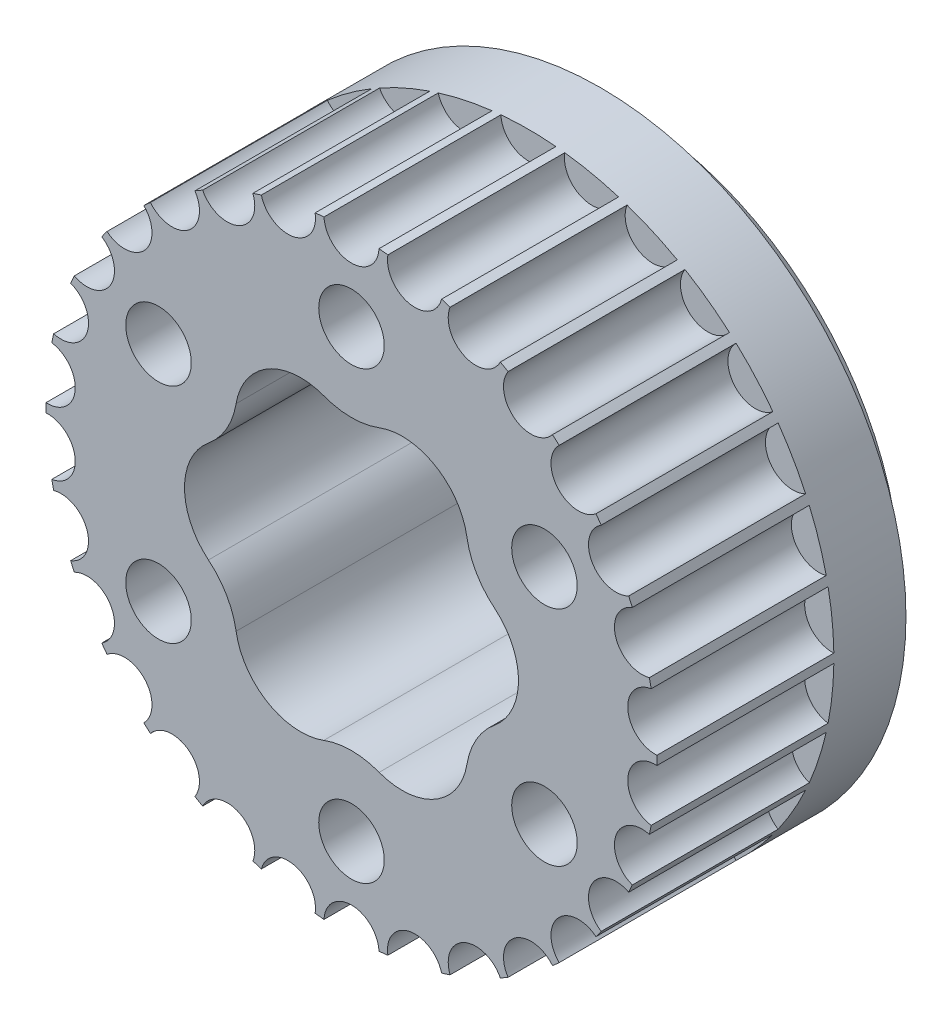
from build123d import *
from build123d.topology import SkipClean

# Parameters (mm, degrees)
CROQUIS1_R                   = 23.305
SALIENTE_EXTRUIR1_DEPTH      = 21
CROQUIS2_R                   = 2.1
CORTAR_EXTRUIR1_DIENTE_DEPTH = 40.079995522
MATRIZC1_DE_DIENTES_COUNT    = 30
SKETCH1_R                    = 23.305
BOSS_EXTRUDE1_DEPTH          = 7.5
SKETCH2_R                    = 23.305
SKETCH2_R_2                  = 22
CUT_EXTRUDE1_DEPTH           = 2
CHAMFER1_SIZE                = 2
CHAMFER1_SIZE_2              = 1.154700538
SKETCH3_R                    = 2.5
CUT_EXTRUDE2_DEPTH           = 40.079995522
CIRPATTERN1_COUNT            = 6
CUT_EXTRUDE3_DEPTH           = 40.079995522
CIRPATTERN2_COUNT            = 6


with BuildPart() as part:
    # Croquis1 → Saliente-Extruir1 (new body)
    with BuildSketch(Plane.XY):
        with Locations(Location((0, 0, 0), (0, 0, 180))):
            Circle(CROQUIS1_R)
    extrude(amount=SALIENTE_EXTRUIR1_DEPTH)

    # Croquis2 → Cortar-Extruir1 diente (cut, through all)
    with BuildSketch(Plane.XY.offset(21)):
        with Locations((0, 23.305)):
            Circle(CROQUIS2_R)
    cortar_extruir1_diente = extrude(amount=-CORTAR_EXTRUIR1_DIENTE_DEPTH, mode=Mode.SUBTRACT)

    # MatrizC1 de dientes: Cortar-Extruir1 diente ×30 about axis
    matrizc1_de_dientes_axis = Axis((0, 0, 0), (0, 0, 1))
    for i in range(1, MATRIZC1_DE_DIENTES_COUNT):
        add(cortar_extruir1_diente.rotate(matrizc1_de_dientes_axis, i * 360 / MATRIZC1_DE_DIENTES_COUNT), mode=Mode.SUBTRACT)

    # Sketch1 → Boss-Extrude1 (add)
    with SkipClean():  # the faces are left unmerged after this step: merging them gives an invalid solid
        with BuildSketch(Plane(origin=(0, 0, 0), x_dir=(-1, 0, 0), z_dir=(0, 0, -1))):
            with Locations(Location((0, 0, 0), (0, 0, 359.164637691))):
                Circle(SKETCH1_R)
        extrude(amount=-BOSS_EXTRUDE1_DEPTH)

    # Sketch2 → Cut-Extrude1 (cut)
    with SkipClean():  # the faces are left unmerged after this step: merging them gives an invalid solid
        with BuildSketch(Plane(origin=(0, 0, 0), x_dir=(-1, 0, 0), z_dir=(0, 0, -1))):
            Circle(SKETCH2_R)
            Circle(SKETCH2_R_2, mode=Mode.SUBTRACT)
        extrude(amount=-CUT_EXTRUDE1_DEPTH, mode=Mode.SUBTRACT)

    # Chamfer1
    # the kernel refuses this chamfer: 2, 1.154700538 mm, written as the material it takes off along each edge
    with BuildSketch(Plane(origin=(0, 0, 0), x_dir=(-1, 0, 0), z_dir=(0, -1, 0))) as chamfer1_piece_1_section:
        Polygon((22, -CHAMFER1_SIZE), (22 - CHAMFER1_SIZE_2, 0), (22, 0), align=None)
    chamfer1_piece_1 = revolve(axis=Axis((0, 0, 0), (0, 0, -1)), revolution_arc=1.835868391, mode=Mode.PRIVATE)
    chamfer1_piece_1 = split(chamfer1_piece_1, bisect_by=Plane(origin=(-21.62879422, 0.346544, 2), z_dir=(0, 0, -1)), keep=Keep.TOP, mode=Mode.PRIVATE)
    with BuildSketch(Plane(origin=(0, 0, 0), x_dir=(-0.9994867007013631, -0.03203646549018377, 0), z_dir=(0.03203646549018377, -0.9994867007013631, 0))) as chamfer1_piece_2_section:
        Polygon((22, -CHAMFER1_SIZE), (22 - CHAMFER1_SIZE_2, 0), (22, 0), align=None)
    chamfer1_piece_2 = revolve(axis=Axis((0, 0, 0), (0, 0, -1)), revolution_arc=1.835868391, mode=Mode.PRIVATE)
    chamfer1_piece_2 = split(chamfer1_piece_2, bisect_by=Plane(origin=(-21.62879422, -0.346544, 2), z_dir=(0, 0, -1)), keep=Keep.TOP, mode=Mode.PRIVATE)
    with BuildSketch(Plane(origin=(0, 0, 0), x_dir=(-0.9994867007013631, 0.0320364654901831, 0), z_dir=(-0.0320364654901831, -0.9994867007013631, 0))) as chamfer1_piece_3_section:
        Polygon((22, -CHAMFER1_SIZE), (22 - CHAMFER1_SIZE_2, 0), (22, 0), align=None)
    chamfer1_piece_3 = revolve(axis=Axis((0, 0, 0), (0, 0, -1)), revolution_arc=8.328263219, mode=Mode.PRIVATE)
    chamfer1_piece_3 = split(chamfer1_piece_3, bisect_by=Plane(origin=(-21.495055877, 2.25922141, 2), z_dir=(0, 0, -1)), keep=Keep.TOP, mode=Mode.PRIVATE)
    with BuildSketch(Plane(origin=(0, 0, 0), x_dir=(-0.9843062739642783, 0.17646857803744895, 0), z_dir=(-0.17646857803744895, -0.9843062739642783, 0))) as chamfer1_piece_4_section:
        Polygon((22, -CHAMFER1_SIZE), (22 - CHAMFER1_SIZE_2, 0), (22, 0), align=None)
    chamfer1_piece_4 = revolve(axis=Axis((0, 0, 0), (0, 0, -1)), revolution_arc=3.671736781, mode=Mode.PRIVATE)
    chamfer1_piece_4 = split(chamfer1_piece_4, bisect_by=Plane(origin=(-21.156153173, 4.496879177, 2), z_dir=(0, 0, -1)), keep=Keep.TOP, mode=Mode.PRIVATE)
    with BuildSketch(Plane(origin=(0, 0, 0), x_dir=(-0.9709847625484951, 0.23914136174790543, 0), z_dir=(-0.23914136174790543, -0.9709847625484951, 0))) as chamfer1_piece_5_section:
        Polygon((22, -CHAMFER1_SIZE), (22 - CHAMFER1_SIZE_2, 0), (22, 0), align=None)
    chamfer1_piece_5 = revolve(axis=Axis((0, 0, 0), (0, 0, -1)), revolution_arc=8.328263219, mode=Mode.PRIVATE)
    chamfer1_piece_5 = split(chamfer1_piece_5, bisect_by=Plane(origin=(-20.555618791, 6.678925413, 2), z_dir=(0, 0, -1)), keep=Keep.TOP, mode=Mode.PRIVATE)
    with BuildSketch(Plane(origin=(0, 0, 0), x_dir=(-0.9261069398293998, 0.37726109791472595, 0), z_dir=(-0.37726109791472595, -0.9261069398293998, 0))) as chamfer1_piece_6_section:
        Polygon((22, -CHAMFER1_SIZE), (22 - CHAMFER1_SIZE_2, 0), (22, 0), align=None)
    chamfer1_piece_6 = revolve(axis=Axis((0, 0, 0), (0, 0, -1)), revolution_arc=3.671736781, mode=Mode.PRIVATE)
    chamfer1_piece_6 = split(chamfer1_piece_6, bisect_by=Plane(origin=(-19.758886714, 8.797223155, 2), z_dir=(0, 0, -1)), keep=Keep.TOP, mode=Mode.PRIVATE)
    with BuildSketch(Plane(origin=(0, 0, 0), x_dir=(-0.9000461309704239, 0.43579463296967164, 0), z_dir=(-0.43579463296967164, -0.9000461309704239, 0))) as chamfer1_piece_7_section:
        Polygon((22, -CHAMFER1_SIZE), (22 - CHAMFER1_SIZE_2, 0), (22, 0), align=None)
    chamfer1_piece_7 = revolve(axis=Axis((0, 0, 0), (0, 0, -1)), revolution_arc=8.328263219, mode=Mode.PRIVATE)
    chamfer1_piece_7 = split(chamfer1_piece_7, bisect_by=Plane(origin=(-18.717802526, 10.806728327, 2), z_dir=(0, 0, -1)), keep=Keep.TOP, mode=Mode.PRIVATE)
    with BuildSketch(Plane(origin=(0, 0, 0), x_dir=(-0.8274322884698772, 0.5615654975134264, 0), z_dir=(-0.5615654975134264, -0.8274322884698772, 0))) as chamfer1_piece_8_section:
        Polygon((22, -CHAMFER1_SIZE), (22 - CHAMFER1_SIZE_2, 0), (22, 0), align=None)
    chamfer1_piece_8 = revolve(axis=Axis((0, 0, 0), (0, 0, -1)), revolution_arc=3.671736781, mode=Mode.PRIVATE)
    chamfer1_piece_8 = split(chamfer1_piece_8, bisect_by=Plane(origin=(-17.498062092, 12.713086267, 2), z_dir=(0, 0, -1)), keep=Keep.TOP, mode=Mode.PRIVATE)
    with BuildSketch(Plane(origin=(0, 0, 0), x_dir=(-0.7897711645684304, 0.6134015875560033, 0), z_dir=(-0.6134015875560033, -0.7897711645684304, 0))) as chamfer1_piece_9_section:
        Polygon((22, -CHAMFER1_SIZE), (22 - CHAMFER1_SIZE_2, 0), (22, 0), align=None)
    chamfer1_piece_9 = revolve(axis=Axis((0, 0, 0), (0, 0, -1)), revolution_arc=8.328263219, mode=Mode.PRIVATE)
    chamfer1_piece_9 = split(chamfer1_piece_9, bisect_by=Plane(origin=(-16.061928473, 14.462225357, 2), z_dir=(0, 0, -1)), keep=Keep.TOP, mode=Mode.PRIVATE)
    with BuildSketch(Plane(origin=(0, 0, 0), x_dir=(-0.6925948756435667, 0.7213267901806174, 0), z_dir=(-0.7213267901806174, -0.6925948756435667, 0))) as chamfer1_piece_10_section:
        Polygon((22, -CHAMFER1_SIZE), (22 - CHAMFER1_SIZE_2, 0), (22, 0), align=None)
    chamfer1_piece_10 = revolve(axis=Axis((0, 0, 0), (0, 0, -1)), revolution_arc=3.671736781, mode=Mode.PRIVATE)
    chamfer1_piece_10 = split(chamfer1_piece_10, bisect_by=Plane(origin=(-14.472488191, 16.073326506, 2), z_dir=(0, 0, -1)), keep=Keep.TOP, mode=Mode.PRIVATE)
    with BuildSketch(Plane(origin=(0, 0, 0), x_dir=(-0.6449794085322867, 0.7641999493387456, 0), z_dir=(-0.7641999493387456, -0.6449794085322867, 0))) as chamfer1_piece_11_section:
        Polygon((22, -CHAMFER1_SIZE), (22 - CHAMFER1_SIZE_2, 0), (22, 0), align=None)
    chamfer1_piece_11 = revolve(axis=Axis((0, 0, 0), (0, 0, -1)), revolution_arc=8.328263219, mode=Mode.PRIVATE)
    chamfer1_piece_11 = split(chamfer1_piece_11, bisect_by=Plane(origin=(-12.704071072, 17.48565374, 2), z_dir=(0, 0, -1)), keep=Keep.TOP, mode=Mode.PRIVATE)
    with BuildSketch(Plane(origin=(0, 0, 0), x_dir=(-0.5274877433126552, 0.8495626408069756, 0), z_dir=(-0.8495626408069756, -0.5274877433126552, 0))) as chamfer1_piece_12_section:
        Polygon((22, -CHAMFER1_SIZE), (22 - CHAMFER1_SIZE_2, 0), (22, 0), align=None)
    chamfer1_piece_12 = revolve(axis=Axis((0, 0, 0), (0, 0, -1)), revolution_arc=3.671736781, mode=Mode.PRIVATE)
    chamfer1_piece_12 = split(chamfer1_piece_12, bisect_by=Plane(origin=(-10.81439711, 18.731085248, 2), z_dir=(0, 0, -1)), keep=Keep.TOP, mode=Mode.PRIVATE)
    with BuildSketch(Plane(origin=(0, 0, 0), x_dir=(-0.47199895738871417, 0.8815991062971688, 0), z_dir=(-0.8815991062971688, -0.47199895738871417, 0))) as chamfer1_piece_13_section:
        Polygon((22, -CHAMFER1_SIZE), (22 - CHAMFER1_SIZE_2, 0), (22, 0), align=None)
    chamfer1_piece_13 = revolve(axis=Axis((0, 0, 0), (0, 0, -1)), revolution_arc=8.328263219, mode=Mode.PRIVATE)
    chamfer1_piece_13 = split(chamfer1_piece_13, bisect_by=Plane(origin=(-8.790984805, 19.74487515, 2), z_dir=(0, 0, -1)), keep=Keep.TOP, mode=Mode.PRIVATE)
    with BuildSketch(Plane(origin=(0, 0, 0), x_dir=(-0.3393268654320094, 0.9406685273761884, 0), z_dir=(-0.9406685273761884, -0.3393268654320094, 0))) as chamfer1_piece_14_section:
        Polygon((22, -CHAMFER1_SIZE), (22 - CHAMFER1_SIZE_2, 0), (22, 0), align=None)
    chamfer1_piece_14 = revolve(axis=Axis((0, 0, 0), (0, 0, -1)), revolution_arc=3.671736781, mode=Mode.PRIVATE)
    chamfer1_piece_14 = split(chamfer1_piece_14, bisect_by=Plane(origin=(-6.683664982, 20.570205683, 2), z_dir=(0, 0, -1)), keep=Keep.TOP, mode=Mode.PRIVATE)
    with BuildSketch(Plane(origin=(0, 0, 0), x_dir=(-0.2783898869049189, 0.9604681519285616, 0), z_dir=(-0.9604681519285616, -0.2783898869049189, 0))) as chamfer1_piece_15_section:
        Polygon((22, -CHAMFER1_SIZE), (22 - CHAMFER1_SIZE_2, 0), (22, 0), align=None)
    chamfer1_piece_15 = revolve(axis=Axis((0, 0, 0), (0, 0, -1)), revolution_arc=8.328263219, mode=Mode.PRIVATE)
    chamfer1_piece_15 = split(chamfer1_piece_15, bisect_by=Plane(origin=(-4.493690317, 21.14115077, 2), z_dir=(0, 0, -1)), keep=Keep.TOP, mode=Mode.PRIVATE)
    with BuildSketch(Plane(origin=(0, 0, 0), x_dir=(-0.13633577526100446, 0.9906626854706807, 0), z_dir=(-0.9906626854706807, -0.13633577526100446, 0))) as chamfer1_piece_16_section:
        Polygon((22, -CHAMFER1_SIZE), (22 - CHAMFER1_SIZE_2, 0), (22, 0), align=None)
    chamfer1_piece_16 = revolve(axis=Axis((0, 0, 0), (0, 0, -1)), revolution_arc=3.671736781, mode=Mode.PRIVATE)
    chamfer1_piece_16 = split(chamfer1_piece_16, bisect_by=Plane(origin=(-2.260824622, 21.510309422, 2), z_dir=(0, 0, -1)), keep=Keep.TOP, mode=Mode.PRIVATE)
    with BuildSketch(Plane(origin=(0, 0, 0), x_dir=(-0.07261384250057941, 0.9973601304831174, 0), z_dir=(-0.9973601304831174, -0.07261384250057941, 0))) as chamfer1_piece_17_section:
        Polygon((22, -CHAMFER1_SIZE), (22 - CHAMFER1_SIZE_2, 0), (22, 0), align=None)
    chamfer1_piece_17 = revolve(axis=Axis((0, 0, 0), (0, 0, -1)), revolution_arc=8.328263219, mode=Mode.PRIVATE)
    chamfer1_piece_17 = split(chamfer1_piece_17, bisect_by=Plane(origin=(0, 21.613456654, 2), z_dir=(0, 0, -1)), keep=Keep.TOP, mode=Mode.PRIVATE)
    with BuildSketch(Plane(origin=(0, 0, 0), x_dir=(0.0726138425005795, 0.9973601304831174, 0), z_dir=(-0.9973601304831174, 0.0726138425005795, 0))) as chamfer1_piece_18_section:
        Polygon((22, -CHAMFER1_SIZE), (22 - CHAMFER1_SIZE_2, 0), (22, 0), align=None)
    chamfer1_piece_18 = revolve(axis=Axis((0, 0, 0), (0, 0, -1)), revolution_arc=3.671736781, mode=Mode.PRIVATE)
    chamfer1_piece_18 = split(chamfer1_piece_18, bisect_by=Plane(origin=(2.260824622, 21.510309422, 2), z_dir=(0, 0, -1)), keep=Keep.TOP, mode=Mode.PRIVATE)
    with BuildSketch(Plane(origin=(0, 0, 0), x_dir=(0.1363357752610048, 0.9906626854706807, 0), z_dir=(-0.9906626854706807, 0.1363357752610048, 0))) as chamfer1_piece_19_section:
        Polygon((22, -CHAMFER1_SIZE), (22 - CHAMFER1_SIZE_2, 0), (22, 0), align=None)
    chamfer1_piece_19 = revolve(axis=Axis((0, 0, 0), (0, 0, -1)), revolution_arc=8.328263219, mode=Mode.PRIVATE)
    chamfer1_piece_19 = split(chamfer1_piece_19, bisect_by=Plane(origin=(4.493690317, 21.14115077, 2), z_dir=(0, 0, -1)), keep=Keep.TOP, mode=Mode.PRIVATE)
    with BuildSketch(Plane(origin=(0, 0, 0), x_dir=(0.27838988690491984, 0.9604681519285613, 0), z_dir=(-0.9604681519285613, 0.27838988690491984, 0))) as chamfer1_piece_20_section:
        Polygon((22, -CHAMFER1_SIZE), (22 - CHAMFER1_SIZE_2, 0), (22, 0), align=None)
    chamfer1_piece_20 = revolve(axis=Axis((0, 0, 0), (0, 0, -1)), revolution_arc=3.671736781, mode=Mode.PRIVATE)
    chamfer1_piece_20 = split(chamfer1_piece_20, bisect_by=Plane(origin=(6.683664982, 20.570205683, 2), z_dir=(0, 0, -1)), keep=Keep.TOP, mode=Mode.PRIVATE)
    with BuildSketch(Plane(origin=(0, 0, 0), x_dir=(0.3393268654320093, 0.9406685273761884, 0), z_dir=(-0.9406685273761884, 0.3393268654320093, 0))) as chamfer1_piece_21_section:
        Polygon((22, -CHAMFER1_SIZE), (22 - CHAMFER1_SIZE_2, 0), (22, 0), align=None)
    chamfer1_piece_21 = revolve(axis=Axis((0, 0, 0), (0, 0, -1)), revolution_arc=8.328263219, mode=Mode.PRIVATE)
    chamfer1_piece_21 = split(chamfer1_piece_21, bisect_by=Plane(origin=(8.790984805, 19.74487515, 2), z_dir=(0, 0, -1)), keep=Keep.TOP, mode=Mode.PRIVATE)
    with BuildSketch(Plane(origin=(0, 0, 0), x_dir=(0.4719989573887134, 0.8815991062971693, 0), z_dir=(-0.8815991062971693, 0.4719989573887134, 0))) as chamfer1_piece_22_section:
        Polygon((22, -CHAMFER1_SIZE), (22 - CHAMFER1_SIZE_2, 0), (22, 0), align=None)
    chamfer1_piece_22 = revolve(axis=Axis((0, 0, 0), (0, 0, -1)), revolution_arc=3.671736781, mode=Mode.PRIVATE)
    chamfer1_piece_22 = split(chamfer1_piece_22, bisect_by=Plane(origin=(10.81439711, 18.731085248, 2), z_dir=(0, 0, -1)), keep=Keep.TOP, mode=Mode.PRIVATE)
    with BuildSketch(Plane(origin=(0, 0, 0), x_dir=(0.5274877433126551, 0.8495626408069757, 0), z_dir=(-0.8495626408069757, 0.5274877433126551, 0))) as chamfer1_piece_23_section:
        Polygon((22, -CHAMFER1_SIZE), (22 - CHAMFER1_SIZE_2, 0), (22, 0), align=None)
    chamfer1_piece_23 = revolve(axis=Axis((0, 0, 0), (0, 0, -1)), revolution_arc=8.328263219, mode=Mode.PRIVATE)
    chamfer1_piece_23 = split(chamfer1_piece_23, bisect_by=Plane(origin=(12.704071072, 17.48565374, 2), z_dir=(0, 0, -1)), keep=Keep.TOP, mode=Mode.PRIVATE)
    with BuildSketch(Plane(origin=(0, 0, 0), x_dir=(0.6449794085322867, 0.7641999493387456, 0), z_dir=(-0.7641999493387456, 0.6449794085322867, 0))) as chamfer1_piece_24_section:
        Polygon((22, -CHAMFER1_SIZE), (22 - CHAMFER1_SIZE_2, 0), (22, 0), align=None)
    chamfer1_piece_24 = revolve(axis=Axis((0, 0, 0), (0, 0, -1)), revolution_arc=3.671736781, mode=Mode.PRIVATE)
    chamfer1_piece_24 = split(chamfer1_piece_24, bisect_by=Plane(origin=(14.472488191, 16.073326506, 2), z_dir=(0, 0, -1)), keep=Keep.TOP, mode=Mode.PRIVATE)
    with BuildSketch(Plane(origin=(0, 0, 0), x_dir=(0.6925948756435674, 0.7213267901806167, 0), z_dir=(-0.7213267901806167, 0.6925948756435674, 0))) as chamfer1_piece_25_section:
        Polygon((22, -CHAMFER1_SIZE), (22 - CHAMFER1_SIZE_2, 0), (22, 0), align=None)
    chamfer1_piece_25 = revolve(axis=Axis((0, 0, 0), (0, 0, -1)), revolution_arc=8.328263219, mode=Mode.PRIVATE)
    chamfer1_piece_25 = split(chamfer1_piece_25, bisect_by=Plane(origin=(16.061928473, 14.462225357, 2), z_dir=(0, 0, -1)), keep=Keep.TOP, mode=Mode.PRIVATE)
    with BuildSketch(Plane(origin=(0, 0, 0), x_dir=(0.7897711645684308, 0.6134015875560028, 0), z_dir=(-0.6134015875560028, 0.7897711645684308, 0))) as chamfer1_piece_26_section:
        Polygon((22, -CHAMFER1_SIZE), (22 - CHAMFER1_SIZE_2, 0), (22, 0), align=None)
    chamfer1_piece_26 = revolve(axis=Axis((0, 0, 0), (0, 0, -1)), revolution_arc=3.671736781, mode=Mode.PRIVATE)
    chamfer1_piece_26 = split(chamfer1_piece_26, bisect_by=Plane(origin=(17.498062092, 12.713086267, 2), z_dir=(0, 0, -1)), keep=Keep.TOP, mode=Mode.PRIVATE)
    with BuildSketch(Plane(origin=(0, 0, 0), x_dir=(0.8274322884698773, 0.5615654975134262, 0), z_dir=(-0.5615654975134262, 0.8274322884698773, 0))) as chamfer1_piece_27_section:
        Polygon((22, -CHAMFER1_SIZE), (22 - CHAMFER1_SIZE_2, 0), (22, 0), align=None)
    chamfer1_piece_27 = revolve(axis=Axis((0, 0, 0), (0, 0, -1)), revolution_arc=8.328263219, mode=Mode.PRIVATE)
    chamfer1_piece_27 = split(chamfer1_piece_27, bisect_by=Plane(origin=(18.717802526, 10.806728327, 2), z_dir=(0, 0, -1)), keep=Keep.TOP, mode=Mode.PRIVATE)
    with BuildSketch(Plane(origin=(0, 0, 0), x_dir=(0.9000461309704235, 0.435794632969672, 0), z_dir=(-0.435794632969672, 0.9000461309704235, 0))) as chamfer1_piece_28_section:
        Polygon((22, -CHAMFER1_SIZE), (22 - CHAMFER1_SIZE_2, 0), (22, 0), align=None)
    chamfer1_piece_28 = revolve(axis=Axis((0, 0, 0), (0, 0, -1)), revolution_arc=3.671736781, mode=Mode.PRIVATE)
    chamfer1_piece_28 = split(chamfer1_piece_28, bisect_by=Plane(origin=(19.758886714, 8.797223155, 2), z_dir=(0, 0, -1)), keep=Keep.TOP, mode=Mode.PRIVATE)
    with BuildSketch(Plane(origin=(0, 0, 0), x_dir=(0.9261069398293997, 0.3772610979147262, 0), z_dir=(-0.3772610979147262, 0.9261069398293997, 0))) as chamfer1_piece_29_section:
        Polygon((22, -CHAMFER1_SIZE), (22 - CHAMFER1_SIZE_2, 0), (22, 0), align=None)
    chamfer1_piece_29 = revolve(axis=Axis((0, 0, 0), (0, 0, -1)), revolution_arc=8.328263219, mode=Mode.PRIVATE)
    chamfer1_piece_29 = split(chamfer1_piece_29, bisect_by=Plane(origin=(20.555618791, 6.678925413, 2), z_dir=(0, 0, -1)), keep=Keep.TOP, mode=Mode.PRIVATE)
    with BuildSketch(Plane(origin=(0, 0, 0), x_dir=(0.9709847625484951, 0.23914136174790543, 0), z_dir=(-0.23914136174790543, 0.9709847625484951, 0))) as chamfer1_piece_30_section:
        Polygon((22, -CHAMFER1_SIZE), (22 - CHAMFER1_SIZE_2, 0), (22, 0), align=None)
    chamfer1_piece_30 = revolve(axis=Axis((0, 0, 0), (0, 0, -1)), revolution_arc=3.671736781, mode=Mode.PRIVATE)
    chamfer1_piece_30 = split(chamfer1_piece_30, bisect_by=Plane(origin=(21.156153173, 4.496879177, 2), z_dir=(0, 0, -1)), keep=Keep.TOP, mode=Mode.PRIVATE)
    with BuildSketch(Plane(origin=(0, 0, 0), x_dir=(0.9843062739642783, 0.17646857803744878, 0), z_dir=(-0.17646857803744878, 0.9843062739642783, 0))) as chamfer1_piece_31_section:
        Polygon((22, -CHAMFER1_SIZE), (22 - CHAMFER1_SIZE_2, 0), (22, 0), align=None)
    chamfer1_piece_31 = revolve(axis=Axis((0, 0, 0), (0, 0, -1)), revolution_arc=8.328263219, mode=Mode.PRIVATE)
    chamfer1_piece_31 = split(chamfer1_piece_31, bisect_by=Plane(origin=(21.495055877, 2.25922141, 2), z_dir=(0, 0, -1)), keep=Keep.TOP, mode=Mode.PRIVATE)
    with BuildSketch(Plane(origin=(0, 0, 0), x_dir=(0.9994867007013631, 0.032036465490183644, 0), z_dir=(-0.032036465490183644, 0.9994867007013631, 0))) as chamfer1_piece_32_section:
        Polygon((22, -CHAMFER1_SIZE), (22 - CHAMFER1_SIZE_2, 0), (22, 0), align=None)
    chamfer1_piece_32 = revolve(axis=Axis((0, 0, 0), (0, 0, -1)), revolution_arc=3.671736781, mode=Mode.PRIVATE)
    chamfer1_piece_32 = split(chamfer1_piece_32, bisect_by=Plane(origin=(21.62879422, 0, 2), z_dir=(0, 0, -1)), keep=Keep.TOP, mode=Mode.PRIVATE)
    with BuildSketch(Plane(origin=(0, 0, 0), x_dir=(0.9994867007013631, -0.0320364654901834, 0), z_dir=(0.0320364654901834, 0.9994867007013631, 0))) as chamfer1_piece_33_section:
        Polygon((22, -CHAMFER1_SIZE), (22 - CHAMFER1_SIZE_2, 0), (22, 0), align=None)
    chamfer1_piece_33 = revolve(axis=Axis((0, 0, 0), (0, 0, -1)), revolution_arc=8.328263219, mode=Mode.PRIVATE)
    chamfer1_piece_33 = split(chamfer1_piece_33, bisect_by=Plane(origin=(21.495055877, -2.25922141, 2), z_dir=(0, 0, -1)), keep=Keep.TOP, mode=Mode.PRIVATE)
    with BuildSketch(Plane(origin=(0, 0, 0), x_dir=(0.9843062739642785, -0.17646857803744811, 0), z_dir=(0.17646857803744811, 0.9843062739642785, 0))) as chamfer1_piece_34_section:
        Polygon((22, -CHAMFER1_SIZE), (22 - CHAMFER1_SIZE_2, 0), (22, 0), align=None)
    chamfer1_piece_34 = revolve(axis=Axis((0, 0, 0), (0, 0, -1)), revolution_arc=3.671736781, mode=Mode.PRIVATE)
    chamfer1_piece_34 = split(chamfer1_piece_34, bisect_by=Plane(origin=(21.156153173, -4.496879177, 2), z_dir=(0, 0, -1)), keep=Keep.TOP, mode=Mode.PRIVATE)
    with BuildSketch(Plane(origin=(0, 0, 0), x_dir=(0.9709847625484952, -0.23914136174790476, 0), z_dir=(0.23914136174790476, 0.9709847625484952, 0))) as chamfer1_piece_35_section:
        Polygon((22, -CHAMFER1_SIZE), (22 - CHAMFER1_SIZE_2, 0), (22, 0), align=None)
    chamfer1_piece_35 = revolve(axis=Axis((0, 0, 0), (0, 0, -1)), revolution_arc=8.328263219, mode=Mode.PRIVATE)
    chamfer1_piece_35 = split(chamfer1_piece_35, bisect_by=Plane(origin=(20.555618791, -6.678925413, 2), z_dir=(0, 0, -1)), keep=Keep.TOP, mode=Mode.PRIVATE)
    with BuildSketch(Plane(origin=(0, 0, 0), x_dir=(0.9261069398293998, -0.37726109791472595, 0), z_dir=(0.37726109791472595, 0.9261069398293998, 0))) as chamfer1_piece_36_section:
        Polygon((22, -CHAMFER1_SIZE), (22 - CHAMFER1_SIZE_2, 0), (22, 0), align=None)
    chamfer1_piece_36 = revolve(axis=Axis((0, 0, 0), (0, 0, -1)), revolution_arc=3.671736781, mode=Mode.PRIVATE)
    chamfer1_piece_36 = split(chamfer1_piece_36, bisect_by=Plane(origin=(19.758886714, -8.797223155, 2), z_dir=(0, 0, -1)), keep=Keep.TOP, mode=Mode.PRIVATE)
    with BuildSketch(Plane(origin=(0, 0, 0), x_dir=(0.9000461309704236, -0.4357946329696718, 0), z_dir=(0.4357946329696718, 0.9000461309704236, 0))) as chamfer1_piece_37_section:
        Polygon((22, -CHAMFER1_SIZE), (22 - CHAMFER1_SIZE_2, 0), (22, 0), align=None)
    chamfer1_piece_37 = revolve(axis=Axis((0, 0, 0), (0, 0, -1)), revolution_arc=8.328263219, mode=Mode.PRIVATE)
    chamfer1_piece_37 = split(chamfer1_piece_37, bisect_by=Plane(origin=(18.717802526, -10.806728327, 2), z_dir=(0, 0, -1)), keep=Keep.TOP, mode=Mode.PRIVATE)
    with BuildSketch(Plane(origin=(0, 0, 0), x_dir=(0.8274322884698772, -0.5615654975134263, 0), z_dir=(0.5615654975134263, 0.8274322884698772, 0))) as chamfer1_piece_38_section:
        Polygon((22, -CHAMFER1_SIZE), (22 - CHAMFER1_SIZE_2, 0), (22, 0), align=None)
    chamfer1_piece_38 = revolve(axis=Axis((0, 0, 0), (0, 0, -1)), revolution_arc=3.671736781, mode=Mode.PRIVATE)
    chamfer1_piece_38 = split(chamfer1_piece_38, bisect_by=Plane(origin=(17.498062092, -12.713086267, 2), z_dir=(0, 0, -1)), keep=Keep.TOP, mode=Mode.PRIVATE)
    with BuildSketch(Plane(origin=(0, 0, 0), x_dir=(0.789771164568431, -0.6134015875560026, 0), z_dir=(0.6134015875560026, 0.789771164568431, 0))) as chamfer1_piece_39_section:
        Polygon((22, -CHAMFER1_SIZE), (22 - CHAMFER1_SIZE_2, 0), (22, 0), align=None)
    chamfer1_piece_39 = revolve(axis=Axis((0, 0, 0), (0, 0, -1)), revolution_arc=8.328263219, mode=Mode.PRIVATE)
    chamfer1_piece_39 = split(chamfer1_piece_39, bisect_by=Plane(origin=(16.061928473, -14.462225357, 2), z_dir=(0, 0, -1)), keep=Keep.TOP, mode=Mode.PRIVATE)
    with BuildSketch(Plane(origin=(0, 0, 0), x_dir=(0.6925948756435676, -0.7213267901806165, 0), z_dir=(0.7213267901806165, 0.6925948756435676, 0))) as chamfer1_piece_40_section:
        Polygon((22, -CHAMFER1_SIZE), (22 - CHAMFER1_SIZE_2, 0), (22, 0), align=None)
    chamfer1_piece_40 = revolve(axis=Axis((0, 0, 0), (0, 0, -1)), revolution_arc=3.671736781, mode=Mode.PRIVATE)
    chamfer1_piece_40 = split(chamfer1_piece_40, bisect_by=Plane(origin=(14.472488191, -16.073326506, 2), z_dir=(0, 0, -1)), keep=Keep.TOP, mode=Mode.PRIVATE)
    with BuildSketch(Plane(origin=(0, 0, 0), x_dir=(0.6449794085322877, -0.7641999493387449, 0), z_dir=(0.7641999493387449, 0.6449794085322877, 0))) as chamfer1_piece_41_section:
        Polygon((22, -CHAMFER1_SIZE), (22 - CHAMFER1_SIZE_2, 0), (22, 0), align=None)
    chamfer1_piece_41 = revolve(axis=Axis((0, 0, 0), (0, 0, -1)), revolution_arc=8.328263219, mode=Mode.PRIVATE)
    chamfer1_piece_41 = split(chamfer1_piece_41, bisect_by=Plane(origin=(12.704071072, -17.48565374, 2), z_dir=(0, 0, -1)), keep=Keep.TOP, mode=Mode.PRIVATE)
    with BuildSketch(Plane(origin=(0, 0, 0), x_dir=(0.5274877433126549, -0.849562640806976, 0), z_dir=(0.849562640806976, 0.5274877433126549, 0))) as chamfer1_piece_42_section:
        Polygon((22, -CHAMFER1_SIZE), (22 - CHAMFER1_SIZE_2, 0), (22, 0), align=None)
    chamfer1_piece_42 = revolve(axis=Axis((0, 0, 0), (0, 0, -1)), revolution_arc=3.671736781, mode=Mode.PRIVATE)
    chamfer1_piece_42 = split(chamfer1_piece_42, bisect_by=Plane(origin=(10.81439711, -18.731085248, 2), z_dir=(0, 0, -1)), keep=Keep.TOP, mode=Mode.PRIVATE)
    with BuildSketch(Plane(origin=(0, 0, 0), x_dir=(0.4719989573887141, -0.881599106297169, 0), z_dir=(0.881599106297169, 0.4719989573887141, 0))) as chamfer1_piece_43_section:
        Polygon((22, -CHAMFER1_SIZE), (22 - CHAMFER1_SIZE_2, 0), (22, 0), align=None)
    chamfer1_piece_43 = revolve(axis=Axis((0, 0, 0), (0, 0, -1)), revolution_arc=8.328263219, mode=Mode.PRIVATE)
    chamfer1_piece_43 = split(chamfer1_piece_43, bisect_by=Plane(origin=(8.790984805, -19.74487515, 2), z_dir=(0, 0, -1)), keep=Keep.TOP, mode=Mode.PRIVATE)
    with BuildSketch(Plane(origin=(0, 0, 0), x_dir=(0.3393268654320087, -0.9406685273761887, 0), z_dir=(0.9406685273761887, 0.3393268654320087, 0))) as chamfer1_piece_44_section:
        Polygon((22, -CHAMFER1_SIZE), (22 - CHAMFER1_SIZE_2, 0), (22, 0), align=None)
    chamfer1_piece_44 = revolve(axis=Axis((0, 0, 0), (0, 0, -1)), revolution_arc=3.671736781, mode=Mode.PRIVATE)
    chamfer1_piece_44 = split(chamfer1_piece_44, bisect_by=Plane(origin=(6.683664982, -20.570205683, 2), z_dir=(0, 0, -1)), keep=Keep.TOP, mode=Mode.PRIVATE)
    with BuildSketch(Plane(origin=(0, 0, 0), x_dir=(0.27838988690491984, -0.9604681519285613, 0), z_dir=(0.9604681519285613, 0.27838988690491984, 0))) as chamfer1_piece_45_section:
        Polygon((22, -CHAMFER1_SIZE), (22 - CHAMFER1_SIZE_2, 0), (22, 0), align=None)
    chamfer1_piece_45 = revolve(axis=Axis((0, 0, 0), (0, 0, -1)), revolution_arc=8.328263219, mode=Mode.PRIVATE)
    chamfer1_piece_45 = split(chamfer1_piece_45, bisect_by=Plane(origin=(4.493690317, -21.14115077, 2), z_dir=(0, 0, -1)), keep=Keep.TOP, mode=Mode.PRIVATE)
    with BuildSketch(Plane(origin=(0, 0, 0), x_dir=(0.13633577526100416, -0.9906626854706808, 0), z_dir=(0.9906626854706808, 0.13633577526100416, 0))) as chamfer1_piece_46_section:
        Polygon((22, -CHAMFER1_SIZE), (22 - CHAMFER1_SIZE_2, 0), (22, 0), align=None)
    chamfer1_piece_46 = revolve(axis=Axis((0, 0, 0), (0, 0, -1)), revolution_arc=3.671736781, mode=Mode.PRIVATE)
    chamfer1_piece_46 = split(chamfer1_piece_46, bisect_by=Plane(origin=(2.260824622, -21.510309422, 2), z_dir=(0, 0, -1)), keep=Keep.TOP, mode=Mode.PRIVATE)
    with BuildSketch(Plane(origin=(0, 0, 0), x_dir=(0.07261384250053833, -0.9973601304831203, 0), z_dir=(0.9973601304831203, 0.07261384250053833, 0))) as chamfer1_piece_47_section:
        Polygon((22, -CHAMFER1_SIZE), (22 - CHAMFER1_SIZE_2, 0), (22, 0), align=None)
    chamfer1_piece_47 = revolve(axis=Axis((0, 0, 0), (0, 0, -1)), revolution_arc=8.328263219, mode=Mode.PRIVATE)
    chamfer1_piece_47 = split(chamfer1_piece_47, bisect_by=Plane(origin=(0, -21.613456654, 2), z_dir=(0, 0, -1)), keep=Keep.TOP, mode=Mode.PRIVATE)
    with BuildSketch(Plane(origin=(0, 0, 0), x_dir=(-0.07261384250053797, -0.9973601304831203, 0), z_dir=(0.9973601304831203, -0.07261384250053797, 0))) as chamfer1_piece_48_section:
        Polygon((22, -CHAMFER1_SIZE), (22 - CHAMFER1_SIZE_2, 0), (22, 0), align=None)
    chamfer1_piece_48 = revolve(axis=Axis((0, 0, 0), (0, 0, -1)), revolution_arc=3.671736781, mode=Mode.PRIVATE)
    chamfer1_piece_48 = split(chamfer1_piece_48, bisect_by=Plane(origin=(-2.260824622, -21.510309422, 2), z_dir=(0, 0, -1)), keep=Keep.TOP, mode=Mode.PRIVATE)
    with BuildSketch(Plane(origin=(0, 0, 0), x_dir=(-0.13633577526100202, -0.990662685470681, 0), z_dir=(0.990662685470681, -0.13633577526100202, 0))) as chamfer1_piece_49_section:
        Polygon((22, -CHAMFER1_SIZE), (22 - CHAMFER1_SIZE_2, 0), (22, 0), align=None)
    chamfer1_piece_49 = revolve(axis=Axis((0, 0, 0), (0, 0, -1)), revolution_arc=8.328263219, mode=Mode.PRIVATE)
    chamfer1_piece_49 = split(chamfer1_piece_49, bisect_by=Plane(origin=(-4.493690317, -21.14115077, 2), z_dir=(0, 0, -1)), keep=Keep.TOP, mode=Mode.PRIVATE)
    with BuildSketch(Plane(origin=(0, 0, 0), x_dir=(-0.2783898869049195, -0.9604681519285614, 0), z_dir=(0.9604681519285614, -0.2783898869049195, 0))) as chamfer1_piece_50_section:
        Polygon((22, -CHAMFER1_SIZE), (22 - CHAMFER1_SIZE_2, 0), (22, 0), align=None)
    chamfer1_piece_50 = revolve(axis=Axis((0, 0, 0), (0, 0, -1)), revolution_arc=3.671736781, mode=Mode.PRIVATE)
    chamfer1_piece_50 = split(chamfer1_piece_50, bisect_by=Plane(origin=(-6.683664982, -20.570205683, 2), z_dir=(0, 0, -1)), keep=Keep.TOP, mode=Mode.PRIVATE)
    with BuildSketch(Plane(origin=(0, 0, 0), x_dir=(-0.3393268654320083, -0.9406685273761888, 0), z_dir=(0.9406685273761888, -0.3393268654320083, 0))) as chamfer1_piece_51_section:
        Polygon((22, -CHAMFER1_SIZE), (22 - CHAMFER1_SIZE_2, 0), (22, 0), align=None)
    chamfer1_piece_51 = revolve(axis=Axis((0, 0, 0), (0, 0, -1)), revolution_arc=8.328263219, mode=Mode.PRIVATE)
    chamfer1_piece_51 = split(chamfer1_piece_51, bisect_by=Plane(origin=(-8.790984805, -19.74487515, 2), z_dir=(0, 0, -1)), keep=Keep.TOP, mode=Mode.PRIVATE)
    with BuildSketch(Plane(origin=(0, 0, 0), x_dir=(-0.47199895738871384, -0.8815991062971691, 0), z_dir=(0.8815991062971691, -0.47199895738871384, 0))) as chamfer1_piece_52_section:
        Polygon((22, -CHAMFER1_SIZE), (22 - CHAMFER1_SIZE_2, 0), (22, 0), align=None)
    chamfer1_piece_52 = revolve(axis=Axis((0, 0, 0), (0, 0, -1)), revolution_arc=3.671736781, mode=Mode.PRIVATE)
    chamfer1_piece_52 = split(chamfer1_piece_52, bisect_by=Plane(origin=(-10.81439711, -18.731085248, 2), z_dir=(0, 0, -1)), keep=Keep.TOP, mode=Mode.PRIVATE)
    with BuildSketch(Plane(origin=(0, 0, 0), x_dir=(-0.5274877433126539, -0.8495626408069765, 0), z_dir=(0.8495626408069765, -0.5274877433126539, 0))) as chamfer1_piece_53_section:
        Polygon((22, -CHAMFER1_SIZE), (22 - CHAMFER1_SIZE_2, 0), (22, 0), align=None)
    chamfer1_piece_53 = revolve(axis=Axis((0, 0, 0), (0, 0, -1)), revolution_arc=8.328263219, mode=Mode.PRIVATE)
    chamfer1_piece_53 = split(chamfer1_piece_53, bisect_by=Plane(origin=(-12.704071072, -17.48565374, 2), z_dir=(0, 0, -1)), keep=Keep.TOP, mode=Mode.PRIVATE)
    with BuildSketch(Plane(origin=(0, 0, 0), x_dir=(-0.6449794085322867, -0.7641999493387458, 0), z_dir=(0.7641999493387458, -0.6449794085322867, 0))) as chamfer1_piece_54_section:
        Polygon((22, -CHAMFER1_SIZE), (22 - CHAMFER1_SIZE_2, 0), (22, 0), align=None)
    chamfer1_piece_54 = revolve(axis=Axis((0, 0, 0), (0, 0, -1)), revolution_arc=3.671736781, mode=Mode.PRIVATE)
    chamfer1_piece_54 = split(chamfer1_piece_54, bisect_by=Plane(origin=(-14.472488191, -16.073326506, 2), z_dir=(0, 0, -1)), keep=Keep.TOP, mode=Mode.PRIVATE)
    with BuildSketch(Plane(origin=(0, 0, 0), x_dir=(-0.6925948756435664, -0.7213267901806177, 0), z_dir=(0.7213267901806177, -0.6925948756435664, 0))) as chamfer1_piece_55_section:
        Polygon((22, -CHAMFER1_SIZE), (22 - CHAMFER1_SIZE_2, 0), (22, 0), align=None)
    chamfer1_piece_55 = revolve(axis=Axis((0, 0, 0), (0, 0, -1)), revolution_arc=8.328263219, mode=Mode.PRIVATE)
    chamfer1_piece_55 = split(chamfer1_piece_55, bisect_by=Plane(origin=(-16.061928473, -14.462225357, 2), z_dir=(0, 0, -1)), keep=Keep.TOP, mode=Mode.PRIVATE)
    with BuildSketch(Plane(origin=(0, 0, 0), x_dir=(-0.7897711645684301, -0.6134015875560036, 0), z_dir=(0.6134015875560036, -0.7897711645684301, 0))) as chamfer1_piece_56_section:
        Polygon((22, -CHAMFER1_SIZE), (22 - CHAMFER1_SIZE_2, 0), (22, 0), align=None)
    chamfer1_piece_56 = revolve(axis=Axis((0, 0, 0), (0, 0, -1)), revolution_arc=3.671736781, mode=Mode.PRIVATE)
    chamfer1_piece_56 = split(chamfer1_piece_56, bisect_by=Plane(origin=(-17.498062092, -12.713086267, 2), z_dir=(0, 0, -1)), keep=Keep.TOP, mode=Mode.PRIVATE)
    with BuildSketch(Plane(origin=(0, 0, 0), x_dir=(-0.8274322884698769, -0.5615654975134267, 0), z_dir=(0.5615654975134267, -0.8274322884698769, 0))) as chamfer1_piece_57_section:
        Polygon((22, -CHAMFER1_SIZE), (22 - CHAMFER1_SIZE_2, 0), (22, 0), align=None)
    chamfer1_piece_57 = revolve(axis=Axis((0, 0, 0), (0, 0, -1)), revolution_arc=8.328263219, mode=Mode.PRIVATE)
    chamfer1_piece_57 = split(chamfer1_piece_57, bisect_by=Plane(origin=(-18.717802526, -10.806728327, 2), z_dir=(0, 0, -1)), keep=Keep.TOP, mode=Mode.PRIVATE)
    with BuildSketch(Plane(origin=(0, 0, 0), x_dir=(-0.900046130970424, -0.4357946329696709, 0), z_dir=(0.4357946329696709, -0.900046130970424, 0))) as chamfer1_piece_58_section:
        Polygon((22, -CHAMFER1_SIZE), (22 - CHAMFER1_SIZE_2, 0), (22, 0), align=None)
    chamfer1_piece_58 = revolve(axis=Axis((0, 0, 0), (0, 0, -1)), revolution_arc=3.671736781, mode=Mode.PRIVATE)
    chamfer1_piece_58 = split(chamfer1_piece_58, bisect_by=Plane(origin=(-19.758886714, -8.797223155, 2), z_dir=(0, 0, -1)), keep=Keep.TOP, mode=Mode.PRIVATE)
    with BuildSketch(Plane(origin=(0, 0, 0), x_dir=(-0.9261069398294303, -0.3772610979146515, 0), z_dir=(0.3772610979146515, -0.9261069398294303, 0))) as chamfer1_piece_59_section:
        Polygon((22, -CHAMFER1_SIZE), (22 - CHAMFER1_SIZE_2, 0), (22, 0), align=None)
    chamfer1_piece_59 = revolve(axis=Axis((0, 0, 0), (0, 0, -1)), revolution_arc=8.328263219, mode=Mode.PRIVATE)
    chamfer1_piece_59 = split(chamfer1_piece_59, bisect_by=Plane(origin=(-20.555618791, -6.678925413, 2), z_dir=(0, 0, -1)), keep=Keep.TOP, mode=Mode.PRIVATE)
    with BuildSketch(Plane(origin=(0, 0, 0), x_dir=(-0.970984762548495, -0.23914136174790598, 0), z_dir=(0.23914136174790598, -0.970984762548495, 0))) as chamfer1_piece_60_section:
        Polygon((22, -CHAMFER1_SIZE), (22 - CHAMFER1_SIZE_2, 0), (22, 0), align=None)
    chamfer1_piece_60 = revolve(axis=Axis((0, 0, 0), (0, 0, -1)), revolution_arc=3.671736781, mode=Mode.PRIVATE)
    chamfer1_piece_60 = split(chamfer1_piece_60, bisect_by=Plane(origin=(-21.156153173, -4.496879177, 2), z_dir=(0, 0, -1)), keep=Keep.TOP, mode=Mode.PRIVATE)
    with BuildSketch(Plane(origin=(0, 0, 0), x_dir=(-0.984306273964278, -0.17646857803745022, 0), z_dir=(0.17646857803745022, -0.984306273964278, 0))) as chamfer1_piece_61_section:
        Polygon((22, -CHAMFER1_SIZE), (22 - CHAMFER1_SIZE_2, 0), (22, 0), align=None)
    chamfer1_piece_61 = revolve(axis=Axis((0, 0, 0), (0, 0, -1)), revolution_arc=8.328263219, mode=Mode.PRIVATE)
    chamfer1_piece_61 = split(chamfer1_piece_61, bisect_by=Plane(origin=(-21.495055877, -2.25922141, 2), z_dir=(0, 0, -1)), keep=Keep.TOP, mode=Mode.PRIVATE)
    add([chamfer1_piece_1, chamfer1_piece_2, chamfer1_piece_3, chamfer1_piece_4, chamfer1_piece_5, chamfer1_piece_6, chamfer1_piece_7, chamfer1_piece_8, chamfer1_piece_9, chamfer1_piece_10, chamfer1_piece_11, chamfer1_piece_12, chamfer1_piece_13, chamfer1_piece_14, chamfer1_piece_15, chamfer1_piece_16, chamfer1_piece_17, chamfer1_piece_18, chamfer1_piece_19, chamfer1_piece_20, chamfer1_piece_21, chamfer1_piece_22, chamfer1_piece_23, chamfer1_piece_24, chamfer1_piece_25, chamfer1_piece_26, chamfer1_piece_27, chamfer1_piece_28, chamfer1_piece_29, chamfer1_piece_30, chamfer1_piece_31, chamfer1_piece_32, chamfer1_piece_33, chamfer1_piece_34, chamfer1_piece_35, chamfer1_piece_36, chamfer1_piece_37, chamfer1_piece_38, chamfer1_piece_39, chamfer1_piece_40, chamfer1_piece_41, chamfer1_piece_42, chamfer1_piece_43, chamfer1_piece_44, chamfer1_piece_45, chamfer1_piece_46, chamfer1_piece_47, chamfer1_piece_48, chamfer1_piece_49, chamfer1_piece_50, chamfer1_piece_51, chamfer1_piece_52, chamfer1_piece_53, chamfer1_piece_54, chamfer1_piece_55, chamfer1_piece_56, chamfer1_piece_57, chamfer1_piece_58, chamfer1_piece_59, chamfer1_piece_60, chamfer1_piece_61], mode=Mode.SUBTRACT)

    # Sketch3 → Cut-Extrude2 (cut, through all)
    with BuildSketch(Plane(origin=(0, 0, 0), x_dir=(-1, 0, 0), z_dir=(0, 0, -1))):
        with Locations((0, 17)):
            Circle(SKETCH3_R)
    cut_extrude2 = extrude(amount=-CUT_EXTRUDE2_DEPTH, mode=Mode.SUBTRACT)

    # CirPattern1: Cut-Extrude2 ×6 about axis
    cirpattern1_axis = Axis((0, 0, 0), (0, 0, 1))
    for i in range(1, CIRPATTERN1_COUNT):
        add(cut_extrude2.rotate(cirpattern1_axis, i * 360 / CIRPATTERN1_COUNT), mode=Mode.SUBTRACT)

    # Sketch5 → Cut-Extrude3 (cut, through all)
    with BuildSketch(Plane(origin=(0, 0, 0), x_dir=(-1, 0, 0), z_dir=(0, 0, -1))):
        with BuildLine():
            Line((-9.526279442, 5.5), (0, 0))
            Line((0, 0), (0, 11))
            ThreePointArc((0, 11), (-1.072783991, 11.096684448), (-2.110994139, 11.38362183))
            ThreePointArc((-2.110994139, 11.38362183), (-6.370155921, 11.033433708), (-8.803008623, 7.519985467))
            ThreePointArc((-8.803008623, 7.519985467), (-9.073618634, 6.477400413), (-9.526279442, 5.5))
        make_face()
    cut_extrude3 = extrude(amount=-CUT_EXTRUDE3_DEPTH, mode=Mode.SUBTRACT)

    # CirPattern2: Cut-Extrude3 ×6 about axis
    cirpattern2_axis = Axis((0, 0, 0), (0, 0, 1))
    for i in range(1, CIRPATTERN2_COUNT):
        add(cut_extrude3.rotate(cirpattern2_axis, i * 360 / CIRPATTERN2_COUNT), mode=Mode.SUBTRACT)


solid = part.part
